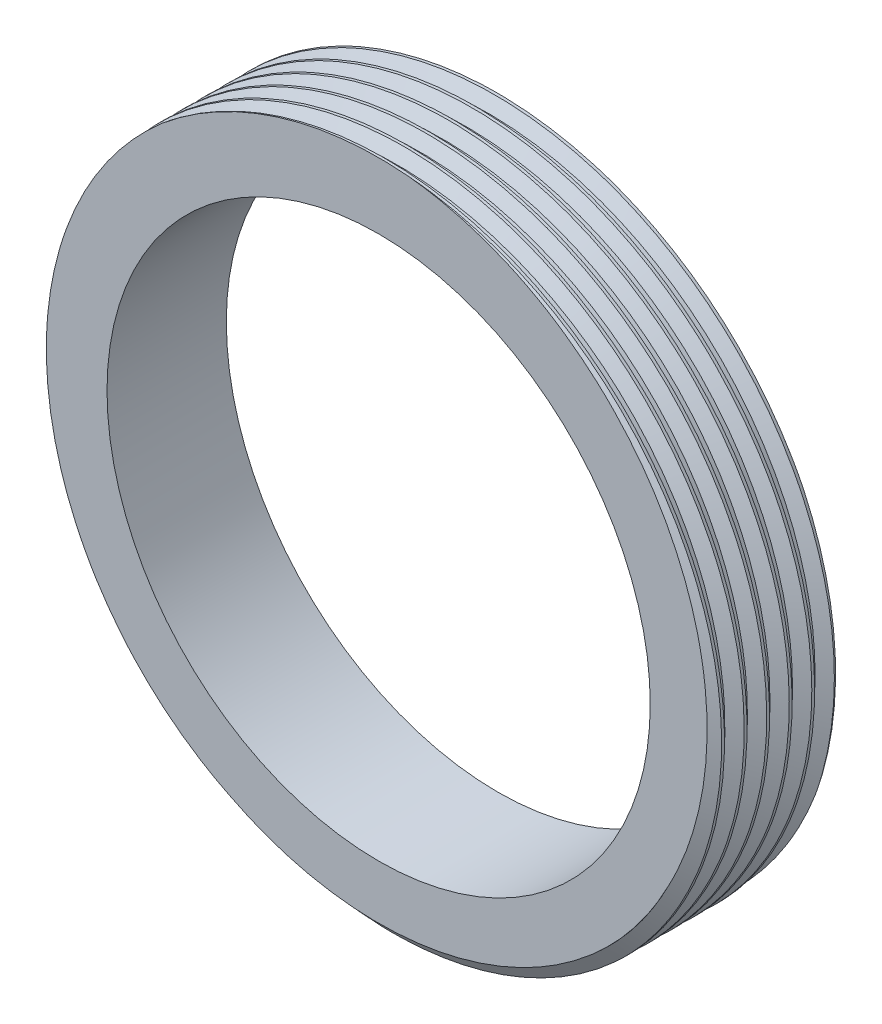
from build123d import *

# Parameters (mm, degrees)
ESQUISSE1_R             = 15.85
BOSS_EXTRU_1_DEPTH      = 5.6
FILETAGE1_PITCH         = 1.058333333
ESQUISSE23_R            = 12.75
ENL_V_MAT_EXTRU_1_DEPTH = 10


with BuildPart() as part:
    # Esquisse1 → Boss.-Extru.1 (new body)
    with BuildSketch(Plane.XY):
        Circle(ESQUISSE1_R)
    extrude(amount=BOSS_EXTRU_1_DEPTH)

    # Filetage1: the profile of Profil de filetage2 profile screwed along a right-hand helix of 6.23622 turns, 8 arcs to a turn; built about Z, then put on its axis
    filetage1_z = Axis((0, 0, 0), (0, 0, 1))
    filetage1_corners = [(15.8503, 0, -0.000173205), (15.8503, 0, 0.926214869), (15.277160282, 0, 0.595312499), (15.277160282, 0, 0.330729165)]
    with BuildLine(mode=Mode.PRIVATE) as filetage1_profile:
        Line(filetage1_corners[0], filetage1_corners[1])
        Line(filetage1_corners[1], filetage1_corners[2])
        Line(filetage1_corners[2], filetage1_corners[3])
        Line(filetage1_corners[3], filetage1_corners[0])
    filetage1_cap = Face(filetage1_profile.wire())
    filetage1_turn_angles = [0, 22.5, 45, 67.5, 90, 112.5, 135, 157.5, 180, 202.5, 225, 247.5, 270, 292.5, 315, 337.5, 360]
    filetage1_turn_weights = [1, 0.9238795325112867, 1, 0.9238795325112867, 1, 0.9238795325112867, 1, 0.9238795325112867, 1, 0.9238795325112867, 1, 0.9238795325112867, 1, 0.9238795325112867, 1, 0.9238795325112867, 1]
    filetage1_turn_rails = [Edge.make_bspline([Vector(p[0], p[1], 0).rotate(filetage1_z, filetage1_turn_angles[k]) / filetage1_turn_weights[k] + Vector(0, 0, p[2] + FILETAGE1_PITCH * filetage1_turn_angles[k] / 360) for k in range(17)], [0, 0, 0, 1, 1, 2, 2, 3, 3, 4, 4, 5, 5, 6, 6, 7, 7, 8, 8, 8], 2, filetage1_turn_weights) for p in filetage1_corners]
    filetage1_turn_sides = [Face.make_surface_from_curves(filetage1_turn_rails[p[0]], filetage1_turn_rails[p[1]]) for p in [(0, 1), (1, 2), (2, 3), (3, 0)]]
    filetage1_last_angles = [2160, 2182.5, 2205, 2225.019685039, 2245.039370079]
    filetage1_last_weights = [1, 0.9238795325112867, 1, 0.9395750578945514, 1]
    filetage1_last_rails = [Edge.make_bspline([Vector(p[0], p[1], 0).rotate(filetage1_z, filetage1_last_angles[k]) / filetage1_last_weights[k] + Vector(0, 0, p[2] + FILETAGE1_PITCH * filetage1_last_angles[k] / 360) for k in range(5)], [0, 0, 0, 1, 1, 2, 2, 2], 2, filetage1_last_weights) for p in filetage1_corners]
    filetage1_last_sides = [Face.make_surface_from_curves(filetage1_last_rails[p[0]], filetage1_last_rails[p[1]]) for p in [(0, 1), (1, 2), (2, 3), (3, 0)]]
    filetage1 = Plane(origin=(0, 0, -1), x_dir=(1, 0, 0), z_dir=(0, 0, 1)) * Solid(Shell([*[p.moved(Location((0, 0, FILETAGE1_PITCH * i))) for i in range(6) for p in filetage1_turn_sides], *filetage1_last_sides, filetage1_cap, filetage1_cap.rotate(filetage1_z, 2245.039370079).moved(Location((0, 0, FILETAGE1_PITCH * 2245.039370079 / 360)))]))
    add(filetage1, mode=Mode.SUBTRACT)

    # Esquisse23 → Enlèv. mat.-Extru.1 (cut)
    with BuildSketch(Plane(origin=(0, 0, 0), x_dir=(-1, 0, 0), z_dir=(0, 0, -1))):
        Circle(ESQUISSE23_R)
    extrude(amount=-ENL_V_MAT_EXTRU_1_DEPTH, mode=Mode.SUBTRACT)


solid = part.part
